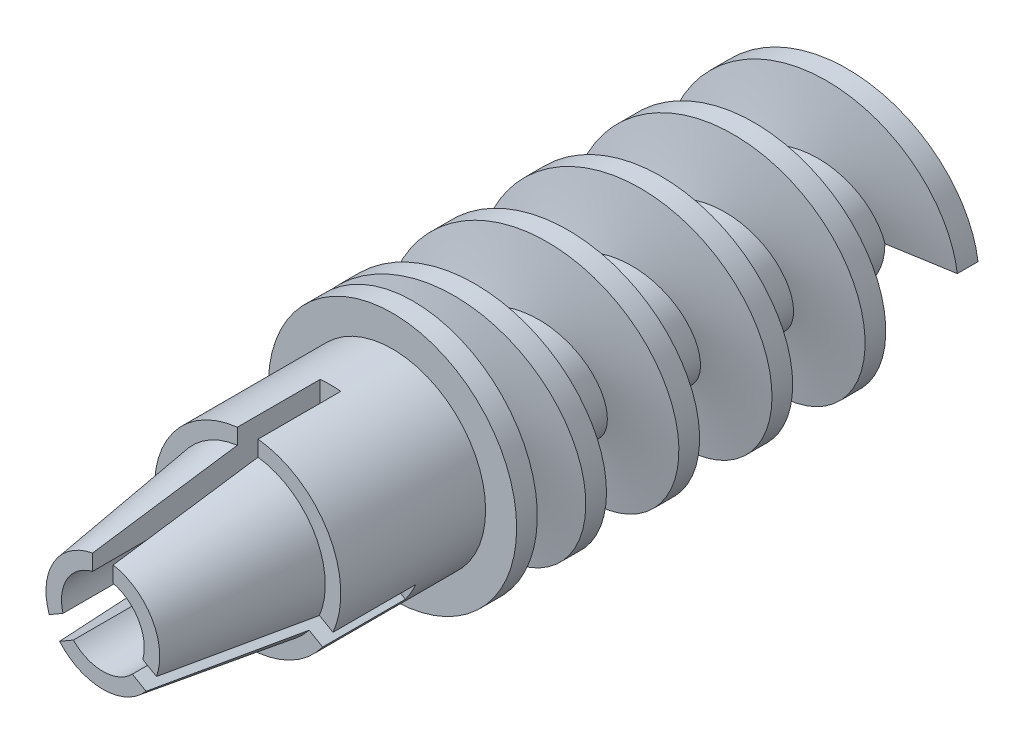
from build123d import *

# Parameters (mm, degrees)
SKETCH_1_R               = 3
SKETCH_1_R_2             = 2
EXTRUDE_1_DEPTH          = 32.5
SWEEP_1_PITCH            = 4.5
CUT_EXTRUDE_1_DEPTH      = 2
CUT_EXTRUDE_2_DEPTH      = 2
CUT_EXTRUDE_2_DEPTH_BACK = 10.7
SKETCH_6_R               = 7
SKETCH_8_R               = 6
EXTRUDE_2_DEPTH          = 1
SKETCH_9_R               = 4.5
EXTRUDE_3_DEPTH          = 7
SKETCH_11_R              = 2.75
SKETCH_10_R              = 3.75
SKETCH_12_R              = 2
CUT_EXTRUDE_3_DEPTH      = 38.765641657
CUT_EXTRUDE_4_DEPTH      = 11


with BuildPart() as part:
    # 草图1 → 凸台-拉伸1 (new body)
    with BuildSketch(Plane.XY):
        Circle(SKETCH_1_R)
        Circle(SKETCH_1_R_2, mode=Mode.SUBTRACT)
    extrude(amount=-EXTRUDE_1_DEPTH)

    # 扫描1: the profile of 草图4 profile screwed along a right-hand helix of 7 turns, 12 arcs to a turn; built about Z, then put on its axis
    sweep_1_z = Axis((0, 0, 0), (0, 0, 1))
    sweep_1_corners = [(2.9997, 0, 1.00005), (2.9997, 0, -1.00005), (6, 0, -0.5), (6, 0, 0.5)]
    with BuildLine(mode=Mode.PRIVATE) as sweep_1_profile:
        Line(sweep_1_corners[0], sweep_1_corners[1])
        Line(sweep_1_corners[1], sweep_1_corners[2])
        Line(sweep_1_corners[2], sweep_1_corners[3])
        Line(sweep_1_corners[3], sweep_1_corners[0])
    sweep_1_cap = Face(sweep_1_profile.wire())
    sweep_1_turn_angles = [0, 15, 30, 45, 60, 75, 90, 105, 120, 135, 150, 165, 180, 195, 210, 225, 240, 255, 270, 285, 300, 315, 330, 345, 360]
    sweep_1_turn_weights = [1, 0.9659258262890683, 1, 0.9659258262890683, 1, 0.9659258262890683, 1, 0.9659258262890683, 1, 0.9659258262890683, 1, 0.9659258262890683, 1, 0.9659258262890683, 1, 0.9659258262890683, 1, 0.9659258262890683, 1, 0.9659258262890683, 1, 0.9659258262890683, 1, 0.9659258262890683, 1]
    sweep_1_turn_rails = [Edge.make_bspline([Vector(p[0], p[1], 0).rotate(sweep_1_z, sweep_1_turn_angles[k]) / sweep_1_turn_weights[k] + Vector(0, 0, p[2] + SWEEP_1_PITCH * sweep_1_turn_angles[k] / 360) for k in range(25)], [0, 0, 0, 1, 1, 2, 2, 3, 3, 4, 4, 5, 5, 6, 6, 7, 7, 8, 8, 9, 9, 10, 10, 11, 11, 12, 12, 12], 2, sweep_1_turn_weights) for p in sweep_1_corners]
    sweep_1_turn_sides = [Face.make_surface_from_curves(sweep_1_turn_rails[p[0]], sweep_1_turn_rails[p[1]]) for p in [(0, 1), (1, 2), (2, 3), (3, 0)]]
    sweep_1 = Plane(origin=(0, 0, 0), x_dir=(1, 0, 0), z_dir=(0, 0, -1)) * Solid(Shell([*[p.moved(Location((0, 0, SWEEP_1_PITCH * i))) for i in range(7) for p in sweep_1_turn_sides], sweep_1_cap, sweep_1_cap.rotate(sweep_1_z, 2520).moved(Location((0, 0, SWEEP_1_PITCH * 2520 / 360)))]))
    add(sweep_1)

    # 草图5 → 切除-拉伸1 (cut)
    with BuildSketch(Plane(origin=(0, 0, -32.5), x_dir=(-1, 0, 0), z_dir=(0, 0, -1))):
        with BuildLine():
            Line((0, 0), (-6, 0))
            ThreePointArc((-6, 0), (0, -6), (6, 0))
            Line((6, 0), (0, 0))
        make_face()
    extrude(amount=-CUT_EXTRUDE_1_DEPTH, mode=Mode.SUBTRACT)

    # 草图6 → 切除-拉伸2 (cut, two sides: drawn at the far end of the back side and taken through both)
    with BuildSketch(Plane.XY.offset(-CUT_EXTRUDE_2_DEPTH_BACK)):
        Circle(SKETCH_6_R)
    extrude(amount=CUT_EXTRUDE_2_DEPTH + CUT_EXTRUDE_2_DEPTH_BACK, mode=Mode.SUBTRACT)

    # 草图8 → 凸台-拉伸2 (add)
    with BuildSketch(Plane.XY.offset(-10.7)):
        with Locations(Location((0, 0, 0), (0, 0, 184.058850395))):
            Circle(SKETCH_8_R)
    extrude(amount=EXTRUDE_2_DEPTH)

    # 草图9 → 凸台-拉伸3 (add)
    with BuildSketch(Plane.XY.offset(-9.7)):
        Circle(SKETCH_9_R)
    extrude(amount=EXTRUDE_3_DEPTH)

    # 草图11 → 放样1 section 0
    with BuildSketch(Plane.XY.offset(4.3)):
        Circle(SKETCH_11_R)
    # 草图10 → 放样1 section 1
    with BuildSketch(Plane.XY.offset(-2.7)):
        Circle(SKETCH_10_R)
    loft()

    # 草图12 → 切除-拉伸3 (cut, through all)
    with BuildSketch(Plane.XY.offset(4.3)):
        Circle(SKETCH_12_R)
    extrude(amount=-CUT_EXTRUDE_3_DEPTH, mode=Mode.SUBTRACT)

    # 草图13 → 切除-拉伸4 (cut)
    with BuildSketch(Plane.XY.offset(4.3)):
        with BuildLine():
            Line((1.927050983, -0.535233135), (4.122983346, -1.803055276))
            ThreePointArc((4.122983346, -1.803055276), (3.897114317, -2.25), (3.622983346, -2.669080679))
            Line((3.622983346, -2.669080679), (1.427050983, -1.401258538))
            ThreePointArc((1.427050983, -1.401258538), (1.732050808, -1), (1.927050983, -0.535233135))
        make_face()
        with BuildLine():
            Line((-0.5, 1.936491673), (-0.5, 4.472135955))
            ThreePointArc((-0.5, 4.472135955), (0, 4.5), (0.5, 4.472135955))
            Line((0.5, 4.472135955), (0.5, 1.936491673))
            ThreePointArc((0.5, 1.936491673), (0, 2), (-0.5, 1.936491673))
        make_face()
        with BuildLine():
            Line((-1.427050983, -1.401258538), (-3.622983346, -2.669080679))
            ThreePointArc((-3.622983346, -2.669080679), (-3.897114317, -2.25), (-4.122983346, -1.803055276))
            Line((-4.122983346, -1.803055276), (-1.927050983, -0.535233135))
            ThreePointArc((-1.927050983, -0.535233135), (-1.732050808, -1), (-1.427050983, -1.401258538))
        make_face()
    extrude(amount=-CUT_EXTRUDE_4_DEPTH, mode=Mode.SUBTRACT)


solid = part.part
